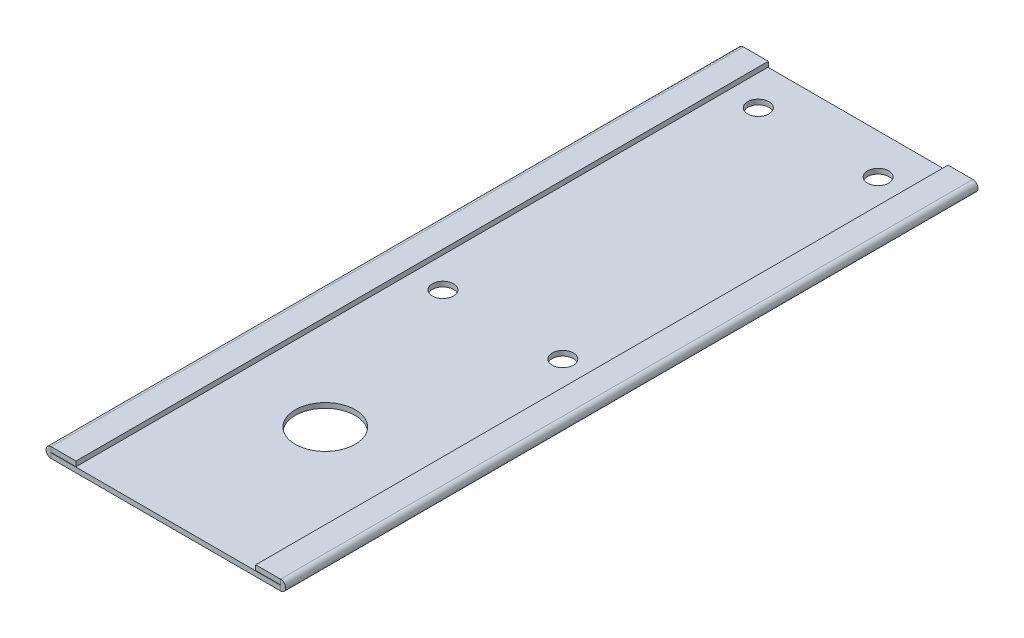
from build123d import *

# Parameters (mm, degrees)
SKETCH1_W          = 76.2
SKETCH1_H          = 220.098493
BASE_FLANGE1_DEPTH = 1.5875
CUT_EXTRUDE1_REACH = 234.921
SKETCH6_R          = 3.3782
SKETCH7_R          = 9.525
CUT_EXTRUDE2_DEPTH = 233.921245869
HEM1_START         = -220.098493
HEM1_DEPTH         = 220.098493
HEM1_2_DEPTH       = 220.098493


# Read off the part's stored shape, not the designer's step: Hem1
# Sheet-metal steps are written as plain solids
with BuildPart() as part:
    # Sketch1 → Base-Flange1 (new body)
    with BuildSketch(Plane(origin=(0, 0, 0), x_dir=(1, 0, 0), z_dir=(0, 1, 0))):
        with Locations((-38.1, 110.0492465)):
            Rectangle(SKETCH1_W, SKETCH1_H)
    extrude(amount=-BASE_FLANGE1_DEPTH)

    # Sketch6 → Cut-Extrude1 (cut, up to next)
    with BuildSketch(Plane(origin=(0, 0, 0), x_dir=(1, 0, 0), z_dir=(0, 1, 0)), mode=Mode.PRIVATE) as cut_extrude1_sk1:
        with Locations(Location((-57.15, 207.398493, 0), (0, 0, 270))):
            Circle(SKETCH6_R)
    cut_extrude1_tool1 = extrude(cut_extrude1_sk1.sketch, amount=-CUT_EXTRUDE1_REACH, mode=Mode.PRIVATE) & part.part
    # Sketch6 → Cut-Extrude1 (cut, up to next)
    with BuildSketch(Plane(origin=(0, 0, 0), x_dir=(1, 0, 0), z_dir=(0, 1, 0)), mode=Mode.PRIVATE) as cut_extrude1_sk2:
        with Locations(Location((-19.05, 207.398493, 0), (0, 0, 270))):
            Circle(SKETCH6_R)
    cut_extrude1_tool2 = extrude(cut_extrude1_sk2.sketch, amount=-CUT_EXTRUDE1_REACH, mode=Mode.PRIVATE) & part.part
    # Sketch6 → Cut-Extrude1 (cut, up to next)
    with BuildSketch(Plane(origin=(0, 0, 0), x_dir=(1, 0, 0), z_dir=(0, 1, 0)), mode=Mode.PRIVATE) as cut_extrude1_sk3:
        with Locations(Location((-19.05, 107.14228, 0), (0, 0, 270))):
            Circle(SKETCH6_R)
    cut_extrude1_tool3 = extrude(cut_extrude1_sk3.sketch, amount=-CUT_EXTRUDE1_REACH, mode=Mode.PRIVATE) & part.part
    # Sketch6 → Cut-Extrude1 (cut, up to next)
    with BuildSketch(Plane(origin=(0, 0, 0), x_dir=(1, 0, 0), z_dir=(0, 1, 0)), mode=Mode.PRIVATE) as cut_extrude1_sk4:
        with Locations(Location((-57.15, 107.14228, 0), (0, 0, 270))):
            Circle(SKETCH6_R)
    cut_extrude1_tool4 = extrude(cut_extrude1_sk4.sketch, amount=-CUT_EXTRUDE1_REACH, mode=Mode.PRIVATE) & part.part
    add(cut_extrude1_tool1.solids().sort_by_distance((-57.15, 0, -207.398493))[0], mode=Mode.SUBTRACT)
    add(cut_extrude1_tool2.solids().sort_by_distance((-19.05, 0, -207.398493))[0], mode=Mode.SUBTRACT)
    add(cut_extrude1_tool3.solids().sort_by_distance((-19.05, 0, -107.14228))[0], mode=Mode.SUBTRACT)
    add(cut_extrude1_tool4.solids().sort_by_distance((-57.15, 0, -107.14228))[0], mode=Mode.SUBTRACT)

    # Sketch7 → Cut-Extrude2 (cut, through all)
    with BuildSketch(Plane(origin=(0, 0, 0), x_dir=(1, 0, 0), z_dir=(0, 1, 0))):
        with Locations(Location((-38.1, 50.680493, 0), (0, 0, 270))):
            Circle(SKETCH7_R)
    extrude(amount=-CUT_EXTRUDE2_DEPTH, mode=Mode.SUBTRACT)

    # Hem1 outline → Hem1 (cut)
    with BuildSketch(Plane.XY.offset(HEM1_START)):
        with BuildLine():
            ThreePointArc((-74.5625, -1.5875), (-75.70257264, -1.125432101), (-76.199236463, 0))
            Line((-76.199236463, 0), (-76.2, 0))
            Line((-76.2, 0), (-76.2, -1.5875))
            Line((-76.2, -1.5875), (-74.5625, -1.5875))
        make_face()
        with BuildLine():
            ThreePointArc((-0.000763537, 0), (-0.49742736, -1.125432101), (-1.6375, -1.5875))
            Line((-1.6375, -1.5875), (0, -1.5875))
            Line((0, -1.5875), (0, 0))
            Line((0, 0), (-0.000763537, 0))
        make_face()
    extrude(amount=HEM1_DEPTH, mode=Mode.SUBTRACT)

    # Hem1 2 outline → Hem1 2 (add)
    with BuildSketch(Plane.XY.offset(HEM1_START)):
        with BuildLine():
            Line((-66.675, 0.1), (-66.675, 1.6875))
            Line((-66.675, 1.6875), (-74.5625, 1.6875))
            ThreePointArc((-74.5625, 1.6875), (-75.737932101, 1.19007264), (-76.199236463, 0))
            Line((-76.199236463, 0), (-74.5625, 0))
            ThreePointArc((-74.5625, 0), (-74.6125, 0.05), (-74.5625, 0.1))
            Line((-74.5625, 0.1), (-66.675, 0.1))
        make_face()
        with BuildLine():
            ThreePointArc((-1.6375, 0.1), (-1.5875, 0.05), (-1.6375, 0))
            Line((-1.6375, 0), (-0.000763537, 0))
            ThreePointArc((-0.000763537, 0), (-0.462067899, 1.19007264), (-1.6375, 1.6875))
            Line((-1.6375, 1.6875), (-9.525, 1.6875))
            Line((-9.525, 1.6875), (-9.525, 0.1))
            Line((-9.525, 0.1), (-1.6375, 0.1))
        make_face()
    extrude(amount=HEM1_2_DEPTH)


solid = part.part
